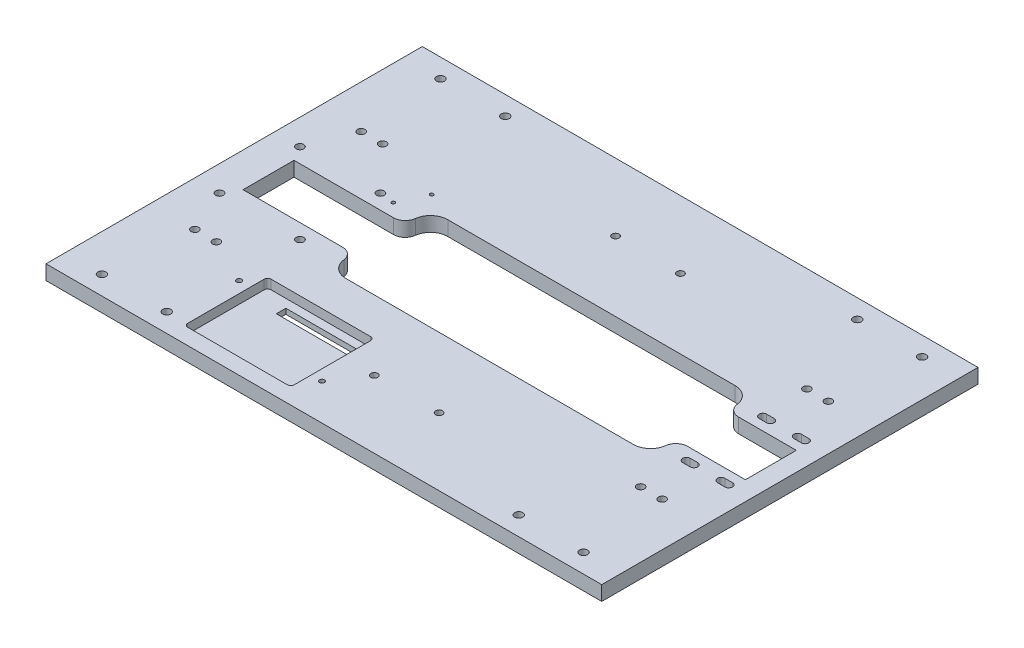
from build123d import *

# Parameters (mm, degrees)
SKETCH1_W           = 480
SKETCH1_H           = 325
BOSS_EXTRUDE1_DEPTH = 12.6
CUT_EXTRUDE1_REACH  = 292.112
SKETCH2_R           = 3
CUT_EXTRUDE2_REACH  = 292.112
FILLET1_R           = 10
CUT_EXTRUDE3_REACH  = 292.112
SKETCH4_R           = 3.3
FILLET2_R           = 10
CUT_EXTRUDE7_REACH  = 292.112
SKETCH7_R           = 2.25
SKETCH7_R_2         = 2.210159971
SKETCH7_R_3         = 2.104405515
SKETCH8_R           = 3.5
CUT_EXTRUDE8_DEPTH  = 6
CUT_EXTRUDE11_REACH = 292.112
SKETCH12_R          = 1.5
FILLET3_R           = 15
CUT_EXTRUDE12_DEPTH = 8
SKETCH14_W          = 63.584161833
SKETCH14_H          = 8.257095536
CUT_EXTRUDE13_DEPTH = 290.948702501
CUT_EXTRUDE14_REACH = 292.112
SKETCH15_R          = 3.25
CUT_EXTRUDE15_REACH = 292.112


with BuildPart() as part:
    # Sketch1 → Boss-Extrude1 (new body)
    with BuildSketch(Plane(origin=(0, 0, 0), x_dir=(1, 0, 0), z_dir=(0, 1, 0))):
        Rectangle(SKETCH1_W, SKETCH1_H)
    extrude(amount=BOSS_EXTRUDE1_DEPTH)

    # Sketch2 → Cut-Extrude1 (cut, up to next)
    with BuildSketch(Plane.XZ, mode=Mode.PRIVATE) as cut_extrude1_sk1:
        with Locations((41.247428317, -104.2)):
            Circle(SKETCH2_R)
    cut_extrude1_tool1 = extrude(cut_extrude1_sk1.sketch, amount=-CUT_EXTRUDE1_REACH, mode=Mode.PRIVATE) & part.part
    # Sketch2 → Cut-Extrude1 (cut, up to next)
    with BuildSketch(Plane.XZ, mode=Mode.PRIVATE) as cut_extrude1_sk2:
        with Locations((-14.752571683, -104.2)):
            Circle(SKETCH2_R)
    cut_extrude1_tool2 = extrude(cut_extrude1_sk2.sketch, amount=-CUT_EXTRUDE1_REACH, mode=Mode.PRIVATE) & part.part
    # Sketch2 → Cut-Extrude1 (cut, up to next)
    with BuildSketch(Plane.XZ, mode=Mode.PRIVATE) as cut_extrude1_sk3:
        with Locations((41.247428317, 104.2)):
            Circle(SKETCH2_R)
    cut_extrude1_tool3 = extrude(cut_extrude1_sk3.sketch, amount=-CUT_EXTRUDE1_REACH, mode=Mode.PRIVATE) & part.part
    # Sketch2 → Cut-Extrude1 (cut, up to next)
    with BuildSketch(Plane.XZ, mode=Mode.PRIVATE) as cut_extrude1_sk4:
        with Locations((-14.752571683, 104.2)):
            Circle(SKETCH2_R)
    cut_extrude1_tool4 = extrude(cut_extrude1_sk4.sketch, amount=-CUT_EXTRUDE1_REACH, mode=Mode.PRIVATE) & part.part
    add(cut_extrude1_tool1.solids().sort_by_distance((41.247428, 0, -104.2))[0], mode=Mode.SUBTRACT)
    add(cut_extrude1_tool2.solids().sort_by_distance((-14.752572, 0, -104.2))[0], mode=Mode.SUBTRACT)
    add(cut_extrude1_tool3.solids().sort_by_distance((41.247428, 0, 104.2))[0], mode=Mode.SUBTRACT)
    add(cut_extrude1_tool4.solids().sort_by_distance((-14.752572, 0, 104.2))[0], mode=Mode.SUBTRACT)

    # Sketch3 → Cut-Extrude2 (cut, up to next)
    with BuildSketch(Plane.XZ, mode=Mode.PRIVATE) as cut_extrude2_sk1:
        Polygon((163.584746975, 44), (-114.288669968, 44), (-114.288669968, 22), (-210.288669968, 22), (-210.288669968, -22), (-114.288669968, -22), (-114.288669968, -44), (163.584746975, -44), (163.584746975, -22), (223.584746975, -22), (223.584746975, 22), (163.584746975, 22), align=None)
    cut_extrude2_tool1 = extrude(cut_extrude2_sk1.sketch, amount=-CUT_EXTRUDE2_REACH, mode=Mode.PRIVATE) & part.part
    add(cut_extrude2_tool1.solids().sort_by_distance((13.675427, 0, 0))[0], mode=Mode.SUBTRACT)

    # Fillet1
    fillet1_edges = [part.edges().sort_by_distance(p)[0] for p in [
        (-114.288669968, 6.3, 22),
        (-114.288669968, 6.3, -22),
    ]]
    fillet(fillet1_edges, radius=FILLET1_R)

    # Sketch4 → Cut-Extrude3 (cut, up to next)
    with BuildSketch(Plane.XZ, mode=Mode.PRIVATE) as cut_extrude3_sk1:
        with Locations((-148.425714853, -34.75)):
            Circle(SKETCH4_R)
    cut_extrude3_tool1 = extrude(cut_extrude3_sk1.sketch, amount=-CUT_EXTRUDE3_REACH, mode=Mode.PRIVATE) & part.part
    # Sketch4 → Cut-Extrude3 (cut, up to next)
    with BuildSketch(Plane.XZ, mode=Mode.PRIVATE) as cut_extrude3_sk2:
        with Locations((-148.425714853, 34.75)):
            Circle(SKETCH4_R)
    cut_extrude3_tool2 = extrude(cut_extrude3_sk2.sketch, amount=-CUT_EXTRUDE3_REACH, mode=Mode.PRIVATE) & part.part
    # Sketch4 → Cut-Extrude3 (cut, up to next)
    with BuildSketch(Plane.XZ, mode=Mode.PRIVATE) as cut_extrude3_sk3:
        with Locations((-217.925714853, 34.75)):
            Circle(SKETCH4_R)
    cut_extrude3_tool3 = extrude(cut_extrude3_sk3.sketch, amount=-CUT_EXTRUDE3_REACH, mode=Mode.PRIVATE) & part.part
    # Sketch4 → Cut-Extrude3 (cut, up to next)
    with BuildSketch(Plane.XZ, mode=Mode.PRIVATE) as cut_extrude3_sk4:
        with Locations((-217.925714853, -34.75)):
            Circle(SKETCH4_R)
    cut_extrude3_tool4 = extrude(cut_extrude3_sk4.sketch, amount=-CUT_EXTRUDE3_REACH, mode=Mode.PRIVATE) & part.part
    add(cut_extrude3_tool1.solids().sort_by_distance((-148.425715, 0, -34.75))[0], mode=Mode.SUBTRACT)
    add(cut_extrude3_tool2.solids().sort_by_distance((-148.425715, 0, 34.75))[0], mode=Mode.SUBTRACT)
    add(cut_extrude3_tool3.solids().sort_by_distance((-217.925715, 0, 34.75))[0], mode=Mode.SUBTRACT)
    add(cut_extrude3_tool4.solids().sort_by_distance((-217.925715, 0, -34.75))[0], mode=Mode.SUBTRACT)

    # Fillet2
    fillet2_edges = [part.edges().sort_by_distance(p)[0] for p in [
        (163.584746975, 6.3, -22),
        (163.584746975, 6.3, 22),
    ]]
    fillet(fillet2_edges, radius=FILLET2_R)

    # Sketch7 → Cut-Extrude7 (cut, up to next)
    with BuildSketch(Plane(origin=(0, 12.6, 0), x_dir=(1, 0, 0), z_dir=(0, 1, 0)), mode=Mode.PRIVATE) as cut_extrude7_sk1:
        with Locations((208, -146.2)):
            Circle(SKETCH7_R)
    cut_extrude7_tool1 = extrude(cut_extrude7_sk1.sketch, amount=-CUT_EXTRUDE7_REACH, mode=Mode.PRIVATE) & part.part
    # Sketch7 → Cut-Extrude7 (cut, up to next)
    with BuildSketch(Plane(origin=(0, 12.6, 0), x_dir=(1, 0, 0), z_dir=(0, 1, 0)), mode=Mode.PRIVATE) as cut_extrude7_sk2:
        with Locations((152, -146.2)):
            Circle(SKETCH7_R)
    cut_extrude7_tool2 = extrude(cut_extrude7_sk2.sketch, amount=-CUT_EXTRUDE7_REACH, mode=Mode.PRIVATE) & part.part
    # Sketch7 → Cut-Extrude7 (cut, up to next)
    with BuildSketch(Plane(origin=(0, 12.6, 0), x_dir=(1, 0, 0), z_dir=(0, 1, 0)), mode=Mode.PRIVATE) as cut_extrude7_sk3:
        with Locations((-152, -146.2)):
            Circle(SKETCH7_R)
    cut_extrude7_tool3 = extrude(cut_extrude7_sk3.sketch, amount=-CUT_EXTRUDE7_REACH, mode=Mode.PRIVATE) & part.part
    # Sketch7 → Cut-Extrude7 (cut, up to next)
    with BuildSketch(Plane(origin=(0, 12.6, 0), x_dir=(1, 0, 0), z_dir=(0, 1, 0)), mode=Mode.PRIVATE) as cut_extrude7_sk4:
        with Locations((-208, -146.2)):
            Circle(SKETCH7_R)
    cut_extrude7_tool4 = extrude(cut_extrude7_sk4.sketch, amount=-CUT_EXTRUDE7_REACH, mode=Mode.PRIVATE) & part.part
    # Sketch7 → Cut-Extrude7 (cut, up to next)
    with BuildSketch(Plane(origin=(0, 12.6, 0), x_dir=(1, 0, 0), z_dir=(0, 1, 0)), mode=Mode.PRIVATE) as cut_extrude7_sk5:
        with Locations((-208, 146.2)):
            Circle(SKETCH7_R)
    cut_extrude7_tool5 = extrude(cut_extrude7_sk5.sketch, amount=-CUT_EXTRUDE7_REACH, mode=Mode.PRIVATE) & part.part
    # Sketch7 → Cut-Extrude7 (cut, up to next)
    with BuildSketch(Plane(origin=(0, 12.6, 0), x_dir=(1, 0, 0), z_dir=(0, 1, 0)), mode=Mode.PRIVATE) as cut_extrude7_sk6:
        with Locations((-152, 146.2)):
            Circle(SKETCH7_R)
    cut_extrude7_tool6 = extrude(cut_extrude7_sk6.sketch, amount=-CUT_EXTRUDE7_REACH, mode=Mode.PRIVATE) & part.part
    # Sketch7 → Cut-Extrude7 (cut, up to next)
    with BuildSketch(Plane(origin=(0, 12.6, 0), x_dir=(1, 0, 0), z_dir=(0, 1, 0)), mode=Mode.PRIVATE) as cut_extrude7_sk7:
        with Locations((208, 146.2)):
            Circle(SKETCH7_R)
    cut_extrude7_tool7 = extrude(cut_extrude7_sk7.sketch, amount=-CUT_EXTRUDE7_REACH, mode=Mode.PRIVATE) & part.part
    # Sketch7 → Cut-Extrude7 (cut, up to next)
    with BuildSketch(Plane(origin=(0, 12.6, 0), x_dir=(1, 0, 0), z_dir=(0, 1, 0)), mode=Mode.PRIVATE) as cut_extrude7_sk8:
        with Locations((152, 146.2)):
            Circle(SKETCH7_R)
    cut_extrude7_tool8 = extrude(cut_extrude7_sk8.sketch, amount=-CUT_EXTRUDE7_REACH, mode=Mode.PRIVATE) & part.part
    # Sketch7 → Cut-Extrude7 (cut, up to next)
    with BuildSketch(Plane(origin=(0, 12.6, 0), x_dir=(1, 0, 0), z_dir=(0, 1, 0)), mode=Mode.PRIVATE) as cut_extrude7_sk9:
        with Locations((-143.975181306, -91.729163581)):
            Circle(SKETCH7_R_2)
    cut_extrude7_tool9 = extrude(cut_extrude7_sk9.sketch, amount=-CUT_EXTRUDE7_REACH, mode=Mode.PRIVATE) & part.part
    # Sketch7 → Cut-Extrude7 (cut, up to next)
    with BuildSketch(Plane(origin=(0, 12.6, 0), x_dir=(1, 0, 0), z_dir=(0, 1, 0)), mode=Mode.PRIVATE) as cut_extrude7_sk10:
        with Locations((-32.975181306, -131.130382474)):
            Circle(SKETCH7_R_3)
    cut_extrude7_tool10 = extrude(cut_extrude7_sk10.sketch, amount=-CUT_EXTRUDE7_REACH, mode=Mode.PRIVATE) & part.part
    add(cut_extrude7_tool1.solids().sort_by_distance((208, 12.6, 146.2))[0], mode=Mode.SUBTRACT)
    add(cut_extrude7_tool2.solids().sort_by_distance((152, 12.6, 146.2))[0], mode=Mode.SUBTRACT)
    add(cut_extrude7_tool3.solids().sort_by_distance((-152, 12.6, 146.2))[0], mode=Mode.SUBTRACT)
    add(cut_extrude7_tool4.solids().sort_by_distance((-208, 12.6, 146.2))[0], mode=Mode.SUBTRACT)
    add(cut_extrude7_tool5.solids().sort_by_distance((-208, 12.6, -146.2))[0], mode=Mode.SUBTRACT)
    add(cut_extrude7_tool6.solids().sort_by_distance((-152, 12.6, -146.2))[0], mode=Mode.SUBTRACT)
    add(cut_extrude7_tool7.solids().sort_by_distance((208, 12.6, -146.2))[0], mode=Mode.SUBTRACT)
    add(cut_extrude7_tool8.solids().sort_by_distance((152, 12.6, -146.2))[0], mode=Mode.SUBTRACT)
    add(cut_extrude7_tool9.solids().sort_by_distance((-143.975181, 12.6, 91.729164))[0], mode=Mode.SUBTRACT)
    add(cut_extrude7_tool10.solids().sort_by_distance((-32.975181, 12.6, 131.130382))[0], mode=Mode.SUBTRACT)

    # Sketch8 → Cut-Extrude8 (cut)
    with BuildSketch(Plane(origin=(0, 12.6, 0), x_dir=(1, 0, 0), z_dir=(0, 1, 0))):
        with Locations((208, 146.2)):
            Circle(SKETCH8_R)
        with Locations((152, 146.2)):
            Circle(SKETCH8_R)
        with Locations((-152, 146.2)):
            Circle(SKETCH8_R)
        with Locations((-208, 146.2)):
            Circle(SKETCH8_R)
        with Locations((208, -146.2)):
            Circle(SKETCH8_R)
        with Locations((152, -146.2)):
            Circle(SKETCH8_R)
        with Locations((-208, -146.2)):
            Circle(SKETCH8_R)
        with Locations((-152, -146.2)):
            Circle(SKETCH8_R)
    extrude(amount=-CUT_EXTRUDE8_DEPTH, mode=Mode.SUBTRACT)

    # Sketch12 → Cut-Extrude11 (cut, up to next)
    with BuildSketch(Plane.XZ, mode=Mode.PRIVATE) as cut_extrude11_sk1:
        with Locations((-135.814791711, -33.263055365)):
            Circle(SKETCH12_R)
    cut_extrude11_tool1 = extrude(cut_extrude11_sk1.sketch, amount=-CUT_EXTRUDE11_REACH, mode=Mode.PRIVATE) & part.part
    # Sketch12 → Cut-Extrude11 (cut, up to next)
    with BuildSketch(Plane.XZ, mode=Mode.PRIVATE) as cut_extrude11_sk2:
        with Locations((-125.214791711, -55.863055365)):
            Circle(SKETCH12_R)
    cut_extrude11_tool2 = extrude(cut_extrude11_sk2.sketch, amount=-CUT_EXTRUDE11_REACH, mode=Mode.PRIVATE) & part.part
    add(cut_extrude11_tool1.solids().sort_by_distance((-135.814792, 0, -33.263055))[0], mode=Mode.SUBTRACT)
    add(cut_extrude11_tool2.solids().sort_by_distance((-125.214792, 0, -55.863055))[0], mode=Mode.SUBTRACT)

    # Fillet3
    fillet3_edges = [part.edges().sort_by_distance(p)[0] for p in [
        (163.584746975, 6.3, 44),
        (163.584746975, 6.3, -44),
        (-114.288669968, 6.3, 44),
        (-114.288669968, 6.3, -44),
    ]]
    fillet(fillet3_edges, radius=FILLET3_R)

    # Sketch9 → Cut-Extrude12 (cut)
    with BuildSketch(Plane(origin=(0, 12.6, 0), x_dir=(1, 0, 0), z_dir=(0, 1, 0))):
        with BuildLine():
            Line((-131.275181306, -76.793200215), (-45.275181306, -76.793200215))
            ThreePointArc((-45.275181306, -76.793200215), (-43.153860962, -77.671879872), (-42.275181306, -79.793200215))
            Line((-42.275181306, -79.793200215), (-42.275181306, -145.793200215))
            ThreePointArc((-42.275181306, -145.793200215), (-43.153860962, -147.914520559), (-45.275181306, -148.793200215))
            Line((-45.275181306, -148.793200215), (-131.275181306, -148.793200215))
            ThreePointArc((-131.275181306, -148.793200215), (-133.396501649, -147.914520559), (-134.275181306, -145.793200215))
            Line((-134.275181306, -145.793200215), (-134.275181306, -79.793200215))
            ThreePointArc((-134.275181306, -79.793200215), (-133.396501649, -77.671879872), (-131.275181306, -76.793200215))
        make_face()
    extrude(amount=-CUT_EXTRUDE12_DEPTH, mode=Mode.SUBTRACT)

    # Sketch14 → Cut-Extrude13 (cut, through all)
    with BuildSketch(Plane(origin=(0, 4.6, 0), x_dir=(1, 0, 0), z_dir=(0, 1, 0))):
        with Locations((-79.365102285, -88.291865052)):
            Rectangle(SKETCH14_W, SKETCH14_H)
    extrude(amount=-CUT_EXTRUDE13_DEPTH, mode=Mode.SUBTRACT)

    # Sketch15 → Cut-Extrude14 (cut, up to next)
    with BuildSketch(Plane(origin=(0, 12.6, 0), x_dir=(1, 0, 0), z_dir=(0, 1, 0)), mode=Mode.PRIVATE) as cut_extrude14_sk1:
        with Locations((-201.37519906, -72.5)):
            Circle(SKETCH15_R)
    cut_extrude14_tool1 = extrude(cut_extrude14_sk1.sketch, amount=-CUT_EXTRUDE14_REACH, mode=Mode.PRIVATE) & part.part
    # Sketch15 → Cut-Extrude14 (cut, up to next)
    with BuildSketch(Plane(origin=(0, 12.6, 0), x_dir=(1, 0, 0), z_dir=(0, 1, 0)), mode=Mode.PRIVATE) as cut_extrude14_sk2:
        with Locations((-182.864719491, -72.5)):
            Circle(SKETCH15_R)
    cut_extrude14_tool2 = extrude(cut_extrude14_sk2.sketch, amount=-CUT_EXTRUDE14_REACH, mode=Mode.PRIVATE) & part.part
    # Sketch15 → Cut-Extrude14 (cut, up to next)
    with BuildSketch(Plane(origin=(0, 12.6, 0), x_dir=(1, 0, 0), z_dir=(0, 1, 0)), mode=Mode.PRIVATE) as cut_extrude14_sk3:
        with Locations((-202.794137534, 72.5)):
            Circle(SKETCH15_R)
    cut_extrude14_tool3 = extrude(cut_extrude14_sk3.sketch, amount=-CUT_EXTRUDE14_REACH, mode=Mode.PRIVATE) & part.part
    # Sketch15 → Cut-Extrude14 (cut, up to next)
    with BuildSketch(Plane(origin=(0, 12.6, 0), x_dir=(1, 0, 0), z_dir=(0, 1, 0)), mode=Mode.PRIVATE) as cut_extrude14_sk4:
        with Locations((-184.283657965, 72.5)):
            Circle(SKETCH15_R)
    cut_extrude14_tool4 = extrude(cut_extrude14_sk4.sketch, amount=-CUT_EXTRUDE14_REACH, mode=Mode.PRIVATE) & part.part
    # Sketch15 → Cut-Extrude14 (cut, up to next)
    with BuildSketch(Plane(origin=(0, 12.6, 0), x_dir=(1, 0, 0), z_dir=(0, 1, 0)), mode=Mode.PRIVATE) as cut_extrude14_sk5:
        with Locations((182.205862466, 72.5)):
            Circle(SKETCH15_R)
    cut_extrude14_tool5 = extrude(cut_extrude14_sk5.sketch, amount=-CUT_EXTRUDE14_REACH, mode=Mode.PRIVATE) & part.part
    # Sketch15 → Cut-Extrude14 (cut, up to next)
    with BuildSketch(Plane(origin=(0, 12.6, 0), x_dir=(1, 0, 0), z_dir=(0, 1, 0)), mode=Mode.PRIVATE) as cut_extrude14_sk6:
        with Locations((200.716342035, 72.5)):
            Circle(SKETCH15_R)
    cut_extrude14_tool6 = extrude(cut_extrude14_sk6.sketch, amount=-CUT_EXTRUDE14_REACH, mode=Mode.PRIVATE) & part.part
    # Sketch15 → Cut-Extrude14 (cut, up to next)
    with BuildSketch(Plane(origin=(0, 12.6, 0), x_dir=(1, 0, 0), z_dir=(0, 1, 0)), mode=Mode.PRIVATE) as cut_extrude14_sk7:
        with Locations((183.62480094, -72.5)):
            Circle(SKETCH15_R)
    cut_extrude14_tool7 = extrude(cut_extrude14_sk7.sketch, amount=-CUT_EXTRUDE14_REACH, mode=Mode.PRIVATE) & part.part
    # Sketch15 → Cut-Extrude14 (cut, up to next)
    with BuildSketch(Plane(origin=(0, 12.6, 0), x_dir=(1, 0, 0), z_dir=(0, 1, 0)), mode=Mode.PRIVATE) as cut_extrude14_sk8:
        with Locations((202.135280509, -72.5)):
            Circle(SKETCH15_R)
    cut_extrude14_tool8 = extrude(cut_extrude14_sk8.sketch, amount=-CUT_EXTRUDE14_REACH, mode=Mode.PRIVATE) & part.part
    add(cut_extrude14_tool1.solids().sort_by_distance((-201.375199, 12.6, 72.5))[0], mode=Mode.SUBTRACT)
    add(cut_extrude14_tool2.solids().sort_by_distance((-182.864719, 12.6, 72.5))[0], mode=Mode.SUBTRACT)
    add(cut_extrude14_tool3.solids().sort_by_distance((-202.794138, 12.6, -72.5))[0], mode=Mode.SUBTRACT)
    add(cut_extrude14_tool4.solids().sort_by_distance((-184.283658, 12.6, -72.5))[0], mode=Mode.SUBTRACT)
    add(cut_extrude14_tool5.solids().sort_by_distance((182.205862, 12.6, -72.5))[0], mode=Mode.SUBTRACT)
    add(cut_extrude14_tool6.solids().sort_by_distance((200.716342, 12.6, -72.5))[0], mode=Mode.SUBTRACT)
    add(cut_extrude14_tool7.solids().sort_by_distance((183.624801, 12.6, 72.5))[0], mode=Mode.SUBTRACT)
    add(cut_extrude14_tool8.solids().sort_by_distance((202.135281, 12.6, 72.5))[0], mode=Mode.SUBTRACT)

    # Sketch16 → Cut-Extrude15 (cut, up to next)
    with BuildSketch(Plane(origin=(0, 12.6, 0), x_dir=(1, 0, 0), z_dir=(0, 1, 0)), mode=Mode.PRIVATE) as cut_extrude15_sk1:
        with BuildLine():
            Line((183.672880587, -36.25), (190.172880587, -36.25))
            ThreePointArc((190.172880587, -36.25), (193.422880587, -33), (190.172880587, -29.75))
            Line((190.172880587, -29.75), (183.672880587, -29.75))
            ThreePointArc((183.672880587, -29.75), (180.422880587, -33), (183.672880587, -36.25))
        make_face()
    cut_extrude15_tool1 = extrude(cut_extrude15_sk1.sketch, amount=-CUT_EXTRUDE15_REACH, mode=Mode.PRIVATE) & part.part
    # Sketch16 → Cut-Extrude15 (cut, up to next)
    with BuildSketch(Plane(origin=(0, 12.6, 0), x_dir=(1, 0, 0), z_dir=(0, 1, 0)), mode=Mode.PRIVATE) as cut_extrude15_sk2:
        with BuildLine():
            Line((213.672880587, -36.25), (220.172880587, -36.25))
            ThreePointArc((220.172880587, -36.25), (223.422880587, -33), (220.172880587, -29.75))
            Line((220.172880587, -29.75), (213.672880587, -29.75))
            ThreePointArc((213.672880587, -29.75), (210.422880587, -33), (213.672880587, -36.25))
        make_face()
    cut_extrude15_tool2 = extrude(cut_extrude15_sk2.sketch, amount=-CUT_EXTRUDE15_REACH, mode=Mode.PRIVATE) & part.part
    # Sketch16 → Cut-Extrude15 (cut, up to next)
    with BuildSketch(Plane(origin=(0, 12.6, 0), x_dir=(1, 0, 0), z_dir=(0, 1, 0)), mode=Mode.PRIVATE) as cut_extrude15_sk3:
        with BuildLine():
            Line((183.672880587, 29.75), (190.172880587, 29.75))
            ThreePointArc((190.172880587, 29.75), (193.422880587, 33), (190.172880587, 36.25))
            Line((190.172880587, 36.25), (183.672880587, 36.25))
            ThreePointArc((183.672880587, 36.25), (180.422880587, 33), (183.672880587, 29.75))
        make_face()
    cut_extrude15_tool3 = extrude(cut_extrude15_sk3.sketch, amount=-CUT_EXTRUDE15_REACH, mode=Mode.PRIVATE) & part.part
    # Sketch16 → Cut-Extrude15 (cut, up to next)
    with BuildSketch(Plane(origin=(0, 12.6, 0), x_dir=(1, 0, 0), z_dir=(0, 1, 0)), mode=Mode.PRIVATE) as cut_extrude15_sk4:
        with BuildLine():
            Line((213.672880587, 29.75), (220.172880587, 29.75))
            ThreePointArc((220.172880587, 29.75), (223.422880587, 33), (220.172880587, 36.25))
            Line((220.172880587, 36.25), (213.672880587, 36.25))
            ThreePointArc((213.672880587, 36.25), (210.422880587, 33), (213.672880587, 29.75))
        make_face()
    cut_extrude15_tool4 = extrude(cut_extrude15_sk4.sketch, amount=-CUT_EXTRUDE15_REACH, mode=Mode.PRIVATE) & part.part
    add(cut_extrude15_tool1.solids().sort_by_distance((186.922881, 12.6, 33))[0], mode=Mode.SUBTRACT)
    add(cut_extrude15_tool2.solids().sort_by_distance((216.922881, 12.6, 33))[0], mode=Mode.SUBTRACT)
    add(cut_extrude15_tool3.solids().sort_by_distance((186.922881, 12.6, -33))[0], mode=Mode.SUBTRACT)
    add(cut_extrude15_tool4.solids().sort_by_distance((216.922881, 12.6, -33))[0], mode=Mode.SUBTRACT)


solid = part.part
